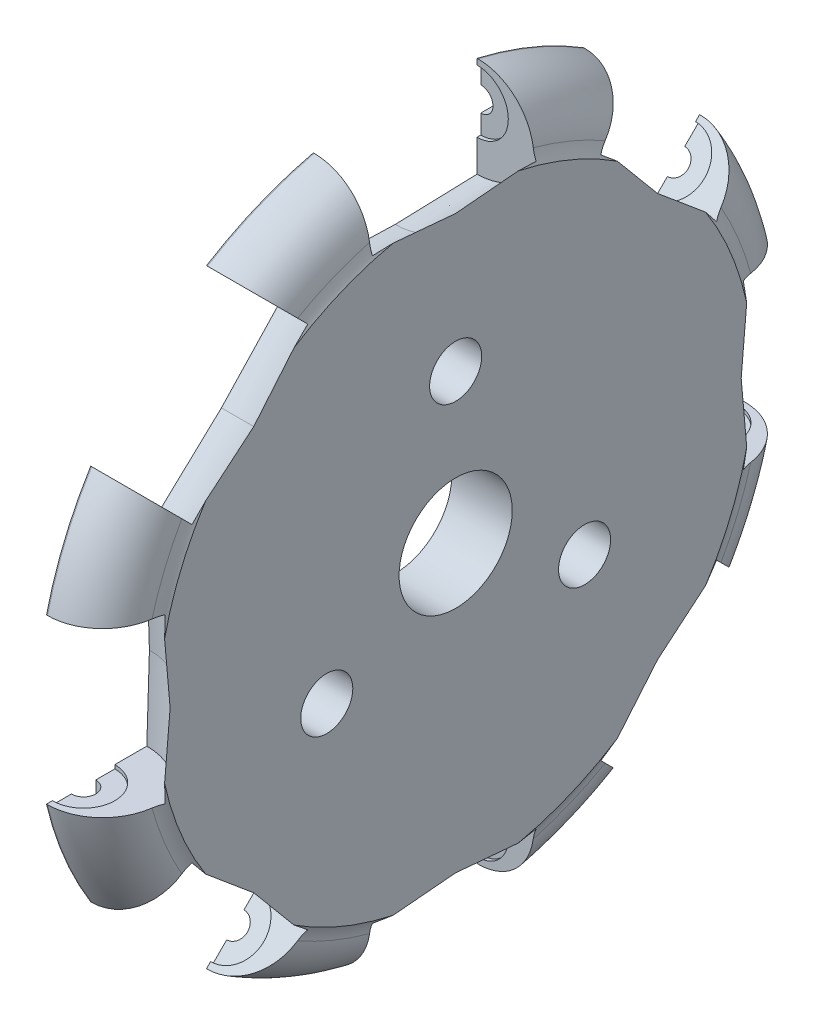
from build123d import *

# Parameters (mm, degrees)
SKETCH1_R           = 30.559375
BOSS_EXTRUDE1_DEPTH = 4.7625
SKETCH2_R           = 25.4
BOSS_EXTRUDE2_DEPTH = 0.396875
SKETCH3_R           = 4.826
SKETCH3_R_2         = 2.2225
CUT_EXTRUDE1_DEPTH  = 44.524360434
FILLET1_R           = 3.175
FILLET2_R           = 4.7625
CIRPATTERN2_COUNT   = 8


# Read off the part's stored shape, not the designer's step: Cavity1
# Some blends are built 0.0001 mm under size
with BuildPart() as part:
    # Sketch1 → Boss-Extrude1 (new body)
    with BuildSketch(Plane(origin=(0, 0, 0), x_dir=(0, 0, -1), z_dir=(1, 0, 0))):
        with Locations(Location((0, 0, 0), (0, 0, 180))):
            Circle(SKETCH1_R)
    extrude(amount=BOSS_EXTRUDE1_DEPTH)

    # Sketch2 → Boss-Extrude2 (add)
    with BuildSketch(Plane(origin=(4.7625, 0, 0), x_dir=(0, 0, -1), z_dir=(1, 0, 0))):
        Circle(SKETCH2_R)
    extrude(amount=BOSS_EXTRUDE2_DEPTH)

    # Sketch3 → Cut-Extrude1 (cut, through all)
    with BuildSketch(Plane(origin=(5.159375, 0, 0), x_dir=(0, 0, -1), z_dir=(1, 0, 0))):
        Circle(SKETCH3_R)
        with Locations((0, 12.7)):
            Circle(SKETCH3_R_2)
        with Locations((10.998522628, -6.35)):
            Circle(SKETCH3_R_2)
        with Locations((-10.998522628, -6.35)):
            Circle(SKETCH3_R_2)
    extrude(amount=-CUT_EXTRUDE1_DEPTH, mode=Mode.SUBTRACT)

    # Fillet1
    # the kernel refuses this fillet: 3.175 mm, written as the material it adds along each edge
    with BuildSketch(Plane(origin=(4.7625, 0, 0), x_dir=(0, 0, -1), z_dir=(0, -1, 0))) as fillet1_piece_1:
        with BuildLine():
            CenterArc((26.937090266, 3.175), FILLET1_R, 241.044975628, 28.955024372)
            Line((25.4, 0.396875), (25.369258195, 0.3413125))
            ThreePointArc((25.369258195, 0.3413125), (25.3365, 0.1984375), (25.3365, 0))
            Line((25.3365, 0), (25.4, -0.0635))
            Line((25.4, -0.0635), (26.937090266, -0.0635))
            Line((26.937090266, -0.0635), (26.937090266, 0))
        make_face()
    revolve(axis=Axis((4.7625, 0, 0), (1, 0, 0)))

    # Fillet2
    fillet2_edges = [part.edges().sort_by_distance(p)[0] for p in [
        (4.7625, 0, -30.559375),
    ]]
    fillet(fillet2_edges, radius=FILLET2_R - 0.0001)  # a hair under: the kernel refuses the full size

    # Cavity1 outline → Cavity1 (revolve, cut)
    with BuildSketch(Plane.XZ.offset(-26.590625)):
        Polygon((0, 9.525), (0, -9.525), (1.0414, -9.525), (1.0414, -7.3025), (2.667, -7.3025), (2.667, -6.985), (5.397504454, -6.985), (5.61975, 0), (5.3975, 6.985), (2.667, 6.985), (2.667, 7.3025), (1.0414, 7.3025), (1.0414, 9.525), align=None)
    cavity1 = revolve(axis=Axis((0, 26.590625, 0), (0, 0, 1)), mode=Mode.SUBTRACT)

    # CirPattern2: Cavity1 ×8 about axis
    cirpattern2_axis = Axis((0, 0, 0), (1, 0, 0))
    for i in range(1, CIRPATTERN2_COUNT):
        add(cavity1.rotate(cirpattern2_axis, i * 360 / CIRPATTERN2_COUNT), mode=Mode.SUBTRACT)


solid = part.part
